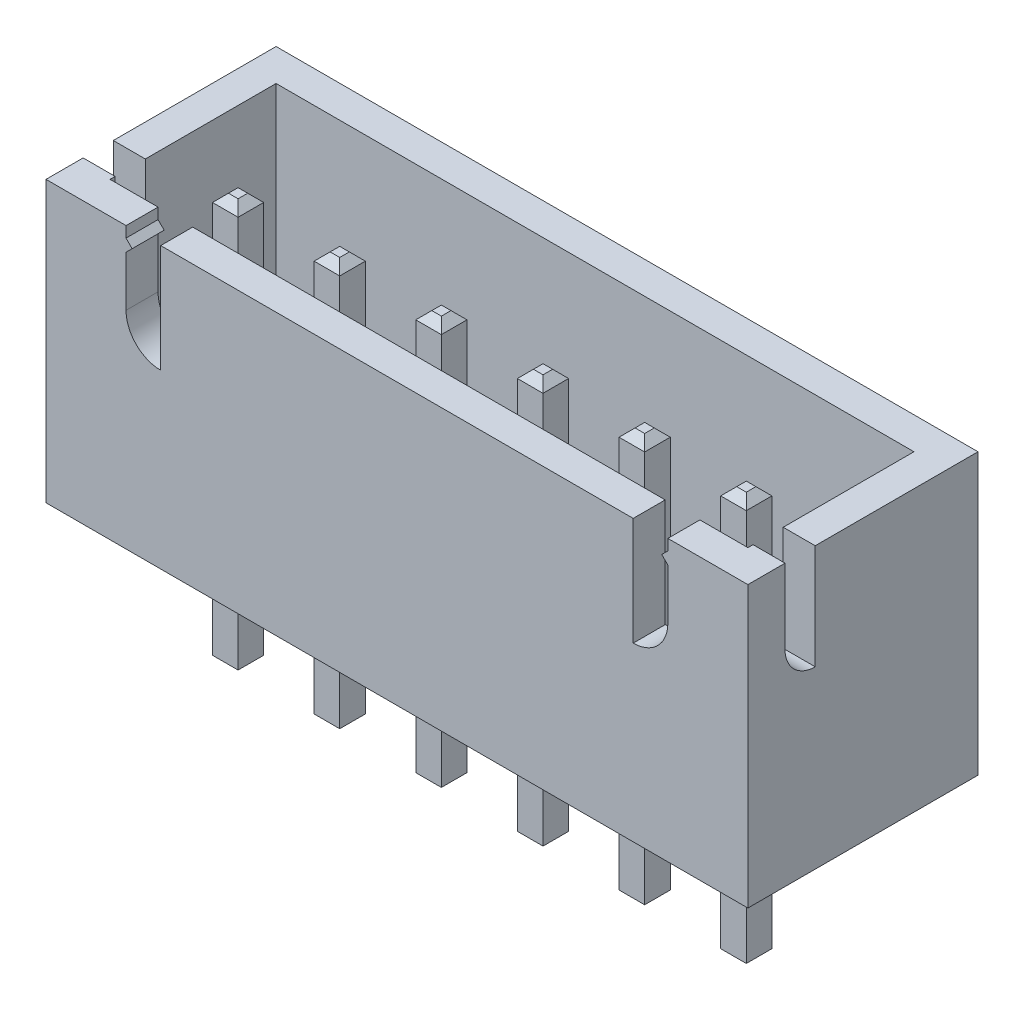
from build123d import *

# Parameters (mm, degrees)
SKETCH1_W                = 17.54
SKETCH1_H                = 5.75
BOSS_EXTRUDE1_DEPTH      = 7
SHELL1_T                 = -0.8
CUT_EXTRUDE1_DEPTH       = 20.102806731
CUT_EXTRUDE2_REACH       = 14.609
BOSS_EXTRUDE2_DEPTH      = 3.45
BOSS_EXTRUDE2_DEPTH_BACK = 6.75
SKETCH4_W                = 0.64
SKETCH4_H                = 0.64
CHAMFER1_SIZE            = 0.2


with BuildPart() as part:
    # Sketch1 → Boss-Extrude1 (new body)
    with BuildSketch(Plane(origin=(0, 0, 0), x_dir=(1, 0, 0), z_dir=(0, 1, 0))):
        Rectangle(SKETCH1_W, SKETCH1_H)
    extrude(amount=BOSS_EXTRUDE1_DEPTH)

    # Shell1
    shell1_openings = [part.faces().sort_by_distance(p)[0] for p in [
        (0, 7, 0),
    ]]
    offset(amount=SHELL1_T, openings=shell1_openings, kind=Kind.INTERSECTION)

    # Sketch2 → Cut-Extrude1 (cut, through all)
    with BuildSketch(Plane(origin=(8.77, 0, 0), x_dir=(0, 0, -1), z_dir=(1, 0, 0))):
        with BuildLine():
            Line((-1.19301282, 7), (-1.19301282, 4.379603984))
            ThreePointArc((-1.19301282, 4.379603984), (-1.72610374, 4.600417472), (-1.946917229, 5.133508392))
            Line((-1.946917229, 5.133508392), (-1.946917229, 7))
            Line((-1.946917229, 7), (-1.19301282, 7))
        make_face()
    extrude(amount=-CUT_EXTRUDE1_DEPTH, mode=Mode.SUBTRACT)

    # Sketch3 → Cut-Extrude2 (cut, up to next)
    with BuildSketch(Plane.XY.offset(2.875), mode=Mode.PRIVATE) as cut_extrude2_sk1:
        with BuildLine():
            Line((-6.77, 7), (-6.77, 6.728922615))
            Line((-6.77, 6.728922615), (-6.617135549, 6.576058164))
            Line((-6.617135549, 6.576058164), (-6.77, 6.423193713))
            Line((-6.77, 6.423193713), (-6.77, 5.166308225))
            ThreePointArc((-6.77, 5.166308225), (-6.516286554, 4.553789782), (-5.90376811, 4.300076336))
            Line((-5.90376811, 4.300076336), (-5.90376811, 7))
            Line((-5.90376811, 7), (-6.77, 7))
        make_face()
    cut_extrude2_tool1 = extrude(cut_extrude2_sk1.sketch, amount=-CUT_EXTRUDE2_REACH, mode=Mode.PRIVATE) & part.part
    # Sketch3 → Cut-Extrude2 (cut, up to next)
    with BuildSketch(Plane.XY.offset(2.875), mode=Mode.PRIVATE) as cut_extrude2_sk2:
        with BuildLine():
            Line((5.90376811, 7), (6.77, 7))
            Line((6.77, 7), (6.77, 6.728922615))
            Line((6.77, 6.728922615), (6.617135549, 6.576058164))
            Line((6.617135549, 6.576058164), (6.77, 6.423193713))
            Line((6.77, 6.423193713), (6.77, 5.166308225))
            ThreePointArc((6.77, 5.166308225), (6.516286554, 4.553789782), (5.90376811, 4.300076336))
            Line((5.90376811, 4.300076336), (5.90376811, 7))
        make_face()
    cut_extrude2_tool2 = extrude(cut_extrude2_sk2.sketch, amount=-CUT_EXTRUDE2_REACH, mode=Mode.PRIVATE) & part.part
    add(cut_extrude2_tool1.solids().sort_by_distance((-6.314828, 5.726435, 2.875))[0], mode=Mode.SUBTRACT)
    add(cut_extrude2_tool2.solids().sort_by_distance((6.314828, 5.726435, 2.875))[0], mode=Mode.SUBTRACT)

    # Sketch4 → Boss-Extrude2 (add, two sides: drawn at the far end of the back side and taken through both)
    with BuildSketch(Plane.XZ.offset(-BOSS_EXTRUDE2_DEPTH_BACK)):
        with Locations((-6.32, 0.525)):
            Rectangle(SKETCH4_W, SKETCH4_H)
        with Locations((-3.78, 0.525)):
            Rectangle(SKETCH4_W, SKETCH4_H)
        with Locations((-1.24, 0.525)):
            Rectangle(SKETCH4_W, SKETCH4_H)
        with Locations((1.3, 0.525)):
            Rectangle(SKETCH4_W, SKETCH4_H)
        with Locations((3.84, 0.525)):
            Rectangle(SKETCH4_W, SKETCH4_H)
        with Locations((6.38, 0.525)):
            Rectangle(SKETCH4_W, SKETCH4_H)
    extrude(amount=BOSS_EXTRUDE2_DEPTH + BOSS_EXTRUDE2_DEPTH_BACK)

    # Chamfer1
    chamfer1_edges = [part.edges().sort_by_distance(p)[0] for p in [
        (6.06, -3.45, 0.525),
        (6.38, -3.45, 0.845),
        (6.7, -3.45, 0.525),
        (6.38, -3.45, 0.205),
        (3.52, -3.45, 0.525),
        (3.84, -3.45, 0.845),
        (4.16, -3.45, 0.525),
        (3.84, -3.45, 0.205),
        (0.98, -3.45, 0.525),
        (1.3, -3.45, 0.845),
        (1.62, -3.45, 0.525),
        (1.3, -3.45, 0.205),
        (-1.56, -3.45, 0.525),
        (-1.24, -3.45, 0.845),
        (-0.92, -3.45, 0.525),
        (-1.24, -3.45, 0.205),
        (-4.1, -3.45, 0.525),
        (-3.78, -3.45, 0.845),
        (-3.46, -3.45, 0.525),
        (-3.78, -3.45, 0.205),
        (-6.32, -3.45, 0.205),
        (-6.64, -3.45, 0.525),
        (-6.32, -3.45, 0.845),
        (-6, -3.45, 0.525),
        (6.7, 6.75, 0.525),
        (6.38, 6.75, 0.845),
        (6.06, 6.75, 0.525),
        (6.38, 6.75, 0.205),
        (4.16, 6.75, 0.525),
        (3.84, 6.75, 0.845),
        (3.52, 6.75, 0.525),
        (3.84, 6.75, 0.205),
        (1.62, 6.75, 0.525),
        (1.3, 6.75, 0.845),
        (0.98, 6.75, 0.525),
        (1.3, 6.75, 0.205),
        (-0.92, 6.75, 0.525),
        (-1.24, 6.75, 0.845),
        (-1.56, 6.75, 0.525),
        (-1.24, 6.75, 0.205),
        (-3.46, 6.75, 0.525),
        (-3.78, 6.75, 0.845),
        (-4.1, 6.75, 0.525),
        (-3.78, 6.75, 0.205),
        (-6.32, 6.75, 0.845),
        (-6.64, 6.75, 0.525),
        (-6.32, 6.75, 0.205),
        (-6, 6.75, 0.525),
    ]]
    chamfer(chamfer1_edges, length=CHAMFER1_SIZE)


solid = part.part
